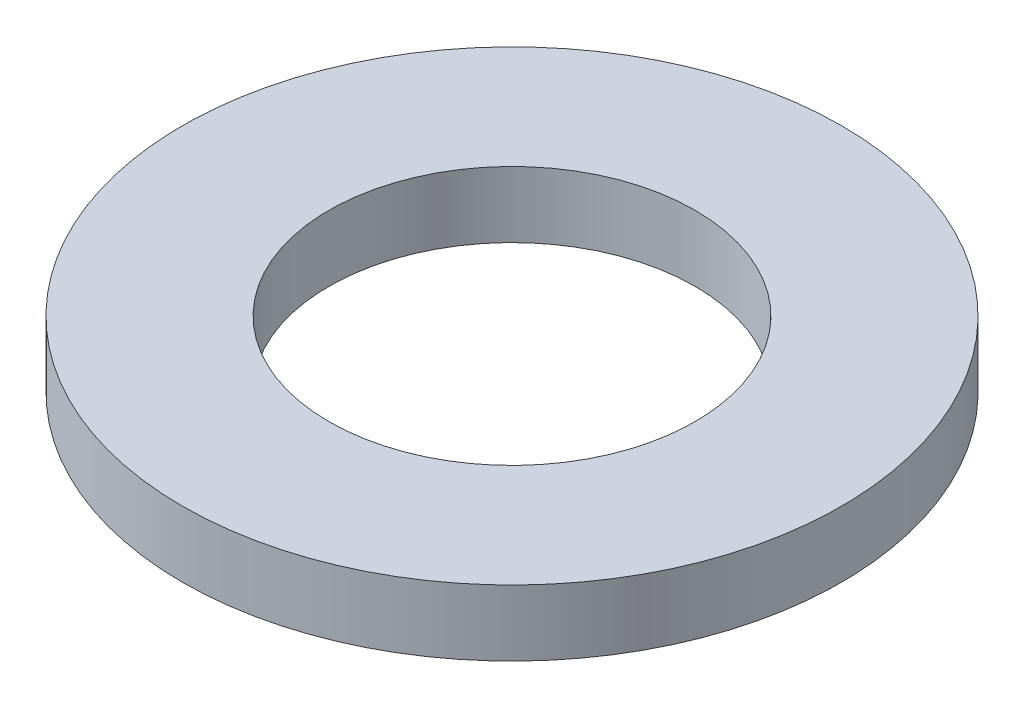
from build123d import *

# Parameters (mm, degrees)
SKETCH1_R           = 90
BOSS_EXTRUDE1_DEPTH = 18
SKETCH2_R           = 50
CUT_EXTRUDE1_DEPTH  = 129.545711714


with BuildPart() as part:
    # Sketch1 → Boss-Extrude1 (new body)
    with BuildSketch(Plane(origin=(0, 0, 0), x_dir=(1, 0, 0), z_dir=(0, 1, 0))):
        Circle(SKETCH1_R)
    extrude(amount=BOSS_EXTRUDE1_DEPTH)

    # Sketch2 → Cut-Extrude1 (cut, through all)
    with BuildSketch(Plane(origin=(0, 0, 0), x_dir=(1, 0, 0), z_dir=(0, 1, 0))):
        Circle(SKETCH2_R)
    extrude(amount=CUT_EXTRUDE1_DEPTH, mode=Mode.SUBTRACT)


solid = part.part
